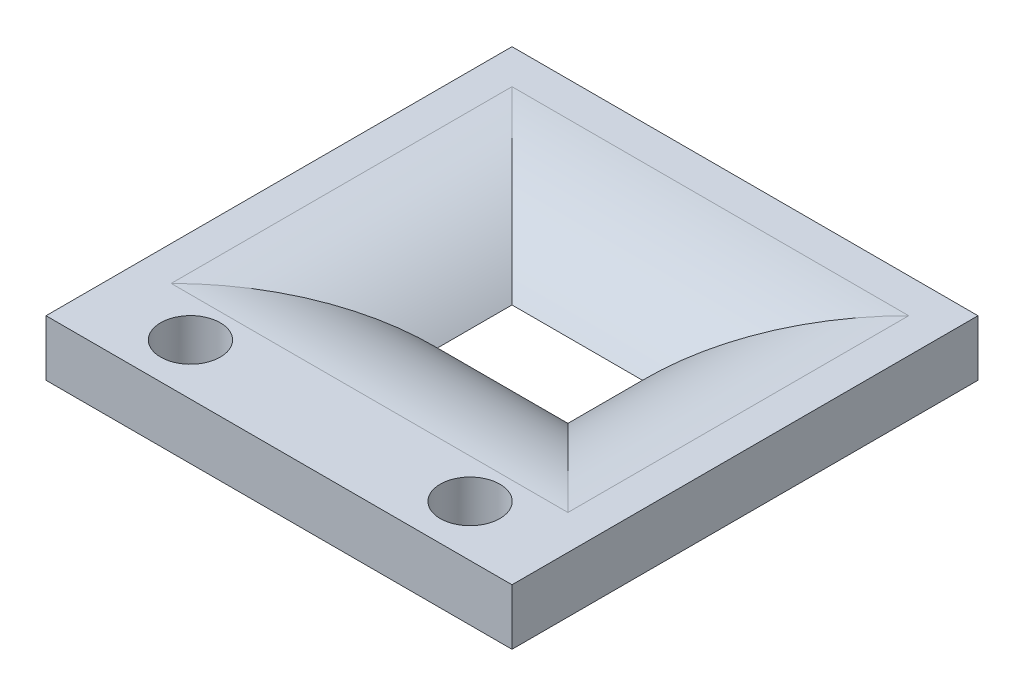
from build123d import *

# Parameters (mm, degrees)
SKETCH1_W                = 25
SKETCH1_H                = 25
BOSS_EXTRUDE1_DEPTH      = 3
M3_CLEARANCE_HOLE1_D     = 3.2
M3_CLEARANCE_HOLE1_DEPTH = 5
M3_CLEARANCE_HOLE1_TIP   = 0.96137699
SKETCH4_W                = 7
SKETCH4_H                = 4
CUT_EXTRUDE1_DEPTH       = 3
FILLET2_R                = 10


with BuildPart() as part:
    # Sketch1 → Boss-Extrude1 (new body)
    with BuildSketch(Plane(origin=(0, 0, 0), x_dir=(1, 0, 0), z_dir=(0, 1, 0))):
        Rectangle(SKETCH1_W, SKETCH1_H)
    extrude(amount=BOSS_EXTRUDE1_DEPTH)

    # M3 Clearance Hole1
    with Locations(Plane(origin=(-7.5, 3, 9.75), x_dir=(0, 0, 1), z_dir=(0, 1, 0))):
        with Locations((0, 0), (0, 15)):
            Hole(M3_CLEARANCE_HOLE1_D / 2, depth=M3_CLEARANCE_HOLE1_DEPTH)
            with Locations((0, 0, -(M3_CLEARANCE_HOLE1_DEPTH + M3_CLEARANCE_HOLE1_TIP / 2))):  # 118° drill point
                Cone(0, M3_CLEARANCE_HOLE1_D / 2, M3_CLEARANCE_HOLE1_TIP, mode=Mode.SUBTRACT)

    # Sketch4 → Cut-Extrude1 (cut)
    with BuildSketch(Plane(origin=(0, 3, 0), x_dir=(1, 0, 0), z_dir=(0, 1, 0))):
        with Locations((0, 1.5)):
            Rectangle(SKETCH4_W, SKETCH4_H)
    extrude(amount=-CUT_EXTRUDE1_DEPTH, mode=Mode.SUBTRACT)

    # Fillet2
    # the kernel refuses this fillet: 10 mm, written as the material it takes off along each edge
    with BuildSketch(Plane(origin=(3.5, 3, 0.5), x_dir=(1, 0, 0), z_dir=(0, 0, -1)), Plane(origin=(-3.5, 3, -3.5), x_dir=(-1, 0, 0), z_dir=(0, 0, 1))) as fillet2_piece_1:
        with BuildLine():
            CenterArc((7.141428429, 10), FILLET2_R, 224.427004001, 45.572995999)
            Line((0, 3), (0, 0))
            Line((0, 0), (7.141428429, 0))
        make_face()
    extrude(amount=4, mode=Mode.SUBTRACT)
    with BuildSketch(Plane(origin=(3.5, 3, -3.5), x_dir=(0, 0, -1), z_dir=(-1, 0, 0)), Plane(origin=(-3.5, 3, 0.5), x_dir=(0, 0, 1), z_dir=(1, 0, 0))) as fillet2_piece_2:
        with BuildLine():
            CenterArc((7.141428429, 10), FILLET2_R, 224.427004001, 45.572995999)
            Line((0, 3), (0, 0))
            Line((0, 0), (7.141428429, 0))
        make_face()
    extrude(amount=7, mode=Mode.SUBTRACT)
    with BuildSketch(Plane(origin=(-3.5, 3, 0.5), x_dir=(0, 0, 1), z_dir=(1, 0, 0))) as fillet2_piece_3a_section:
        with BuildLine():
            CenterArc((7.141428429, 10), FILLET2_R, 224.427004001, 45.572995999)
            Line((0, 3), (0, 0))
            Line((0, 0), (7.141428429, 0))
        make_face()
    fillet2_piece_3a = extrude(amount=24.853571071, mode=Mode.PRIVATE)
    fillet2_piece_3a = split(fillet2_piece_3a, bisect_by=Plane(origin=(12.5, 3, 0.5), z_dir=(-1, 0, 0)), keep=Keep.TOP, mode=Mode.PRIVATE)
    fillet2_piece_3a = split(fillet2_piece_3a, bisect_by=Plane(origin=(3.5, 3, 0.5), z_dir=(1, 0, 0)), keep=Keep.TOP, mode=Mode.PRIVATE)
    with BuildSketch(Plane(origin=(3.5, 3, 18.353571071), x_dir=(1, 0, 0), z_dir=(0, 0, -1))) as fillet2_piece_3b_section:
        with BuildLine():
            CenterArc((7.141428429, 10), FILLET2_R, 224.427004001, 45.572995999)
            Line((0, 3), (0, 0))
            Line((0, 0), (7.141428429, 0))
        make_face()
    fillet2_piece_3b = extrude(amount=21.853571071, mode=Mode.PRIVATE)
    fillet2_piece_3b = split(fillet2_piece_3b, bisect_by=Plane(origin=(3.5, 3, 12.5), z_dir=(0, 0, -1)), keep=Keep.TOP, mode=Mode.PRIVATE)
    fillet2_piece_3b = fillet2_piece_3b - Plane(origin=(7.5, 3, 9.75), x_dir=(0, 0, -1), z_dir=(0, -1, 0)) * Cylinder(1.6, 73, mode=Mode.PRIVATE)
    fillet2_piece_3b = split(fillet2_piece_3b, bisect_by=Plane(origin=(3.5, 3, 0.5), z_dir=(0, 0, 1)), keep=Keep.TOP, mode=Mode.PRIVATE)
    fillet2_piece_3 = fillet2_piece_3a & fillet2_piece_3b
    add(fillet2_piece_3, mode=Mode.SUBTRACT)
    with BuildSketch(Plane(origin=(3.5, 3, 0.5), x_dir=(1, 0, 0), z_dir=(0, 0, -1))) as fillet2_piece_4a_section:
        with BuildLine():
            CenterArc((7.141428429, 10), FILLET2_R, 224.427004001, 45.572995999)
            Line((0, 3), (0, 0))
            Line((0, 0), (7.141428429, 0))
        make_face()
    fillet2_piece_4a = extrude(amount=21.853571071, mode=Mode.PRIVATE)
    fillet2_piece_4a = split(fillet2_piece_4a, bisect_by=Plane(origin=(3.5, 3, -12.5), z_dir=(0, 0, 1)), keep=Keep.TOP, mode=Mode.PRIVATE)
    fillet2_piece_4a = split(fillet2_piece_4a, bisect_by=Plane(origin=(3.5, 3, -3.5), z_dir=(0, 0, -1)), keep=Keep.TOP, mode=Mode.PRIVATE)
    with BuildSketch(Plane(origin=(21.353571071, 3, -3.5), x_dir=(0, 0, -1), z_dir=(-1, 0, 0))) as fillet2_piece_4b_section:
        with BuildLine():
            CenterArc((7.141428429, 10), FILLET2_R, 224.427004001, 45.572995999)
            Line((0, 3), (0, 0))
            Line((0, 0), (7.141428429, 0))
        make_face()
    fillet2_piece_4b = extrude(amount=24.853571071, mode=Mode.PRIVATE)
    fillet2_piece_4b = split(fillet2_piece_4b, bisect_by=Plane(origin=(12.5, 3, -3.5), z_dir=(-1, 0, 0)), keep=Keep.TOP, mode=Mode.PRIVATE)
    fillet2_piece_4b = split(fillet2_piece_4b, bisect_by=Plane(origin=(3.5, 3, -3.5), z_dir=(1, 0, 0)), keep=Keep.TOP, mode=Mode.PRIVATE)
    fillet2_piece_4 = fillet2_piece_4a & fillet2_piece_4b
    add(fillet2_piece_4, mode=Mode.SUBTRACT)
    with BuildSketch(Plane(origin=(3.5, 3, -3.5), x_dir=(0, 0, -1), z_dir=(-1, 0, 0))) as fillet2_piece_5a_section:
        with BuildLine():
            CenterArc((7.141428429, 10), FILLET2_R, 224.427004001, 45.572995999)
            Line((0, 3), (0, 0))
            Line((0, 0), (7.141428429, 0))
        make_face()
    fillet2_piece_5a = extrude(amount=24.853571071, mode=Mode.PRIVATE)
    fillet2_piece_5a = split(fillet2_piece_5a, bisect_by=Plane(origin=(-12.5, 3, -3.5), z_dir=(1, 0, 0)), keep=Keep.TOP, mode=Mode.PRIVATE)
    fillet2_piece_5a = split(fillet2_piece_5a, bisect_by=Plane(origin=(-3.5, 3, -3.5), z_dir=(-1, 0, 0)), keep=Keep.TOP, mode=Mode.PRIVATE)
    with BuildSketch(Plane(origin=(-3.5, 3, -21.353571071), x_dir=(-1, 0, 0), z_dir=(0, 0, 1))) as fillet2_piece_5b_section:
        with BuildLine():
            CenterArc((7.141428429, 10), FILLET2_R, 224.427004001, 45.572995999)
            Line((0, 3), (0, 0))
            Line((0, 0), (7.141428429, 0))
        make_face()
    fillet2_piece_5b = extrude(amount=21.853571071, mode=Mode.PRIVATE)
    fillet2_piece_5b = split(fillet2_piece_5b, bisect_by=Plane(origin=(-3.5, 3, -12.5), z_dir=(0, 0, 1)), keep=Keep.TOP, mode=Mode.PRIVATE)
    fillet2_piece_5b = split(fillet2_piece_5b, bisect_by=Plane(origin=(-3.5, 3, -3.5), z_dir=(0, 0, -1)), keep=Keep.TOP, mode=Mode.PRIVATE)
    fillet2_piece_5 = fillet2_piece_5a & fillet2_piece_5b
    add(fillet2_piece_5, mode=Mode.SUBTRACT)
    with BuildSketch(Plane(origin=(-21.353571071, 3, 0.5), x_dir=(0, 0, 1), z_dir=(1, 0, 0))) as fillet2_piece_6a_section:
        with BuildLine():
            CenterArc((7.141428429, 10), FILLET2_R, 224.427004001, 45.572995999)
            Line((0, 3), (0, 0))
            Line((0, 0), (7.141428429, 0))
        make_face()
    fillet2_piece_6a = extrude(amount=24.853571071, mode=Mode.PRIVATE)
    fillet2_piece_6a = split(fillet2_piece_6a, bisect_by=Plane(origin=(-12.5, 3, 0.5), z_dir=(1, 0, 0)), keep=Keep.TOP, mode=Mode.PRIVATE)
    fillet2_piece_6a = split(fillet2_piece_6a, bisect_by=Plane(origin=(-3.5, 3, 0.5), z_dir=(-1, 0, 0)), keep=Keep.TOP, mode=Mode.PRIVATE)
    with BuildSketch(Plane(origin=(-3.5, 3, -3.5), x_dir=(-1, 0, 0), z_dir=(0, 0, 1))) as fillet2_piece_6b_section:
        with BuildLine():
            CenterArc((7.141428429, 10), FILLET2_R, 224.427004001, 45.572995999)
            Line((0, 3), (0, 0))
            Line((0, 0), (7.141428429, 0))
        make_face()
    fillet2_piece_6b = extrude(amount=21.853571071, mode=Mode.PRIVATE)
    fillet2_piece_6b = split(fillet2_piece_6b, bisect_by=Plane(origin=(-3.5, 3, 12.5), z_dir=(0, 0, -1)), keep=Keep.TOP, mode=Mode.PRIVATE)
    fillet2_piece_6b = fillet2_piece_6b - Plane(origin=(-7.5, 3, 9.75), x_dir=(0, 0, -1), z_dir=(0, -1, 0)) * Cylinder(1.6, 73, mode=Mode.PRIVATE)
    fillet2_piece_6b = split(fillet2_piece_6b, bisect_by=Plane(origin=(-3.5, 3, 0.5), z_dir=(0, 0, 1)), keep=Keep.TOP, mode=Mode.PRIVATE)
    fillet2_piece_6 = fillet2_piece_6a & fillet2_piece_6b
    add(fillet2_piece_6, mode=Mode.SUBTRACT)


solid = part.part
